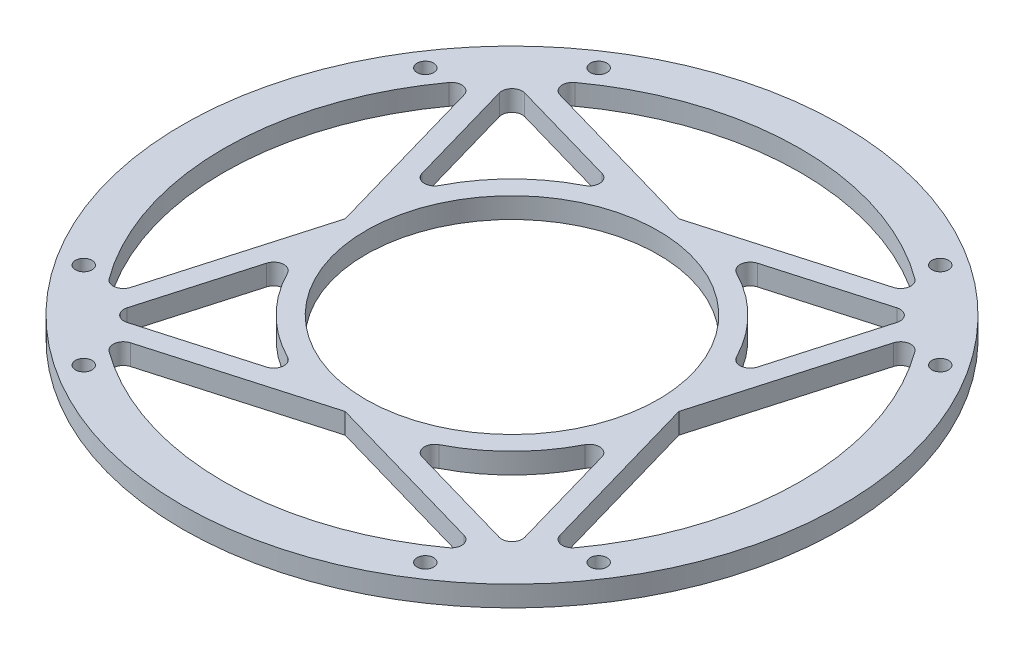
from build123d import *

# Parameters (mm, degrees)
SKETCH1_R                = 101.6
BOSS_EXTRUDE1_DEPTH      = 6.35
SKETCH4_R                = 45.085
CUT_EXTRUDE1_DEPTH       = 144.824345992
CUT_EXTRUDE2_DEPTH       = 144.824345992
F_10_CLEARANCE_HOLE1_D   = 5.1054
FILLET1_R                = 3.175
CIRPATTERN1_COUNT        = 4
FILLET1_OF_CIRPATTERN1_R = 3.175


with BuildPart() as part:
    # Sketch1 → Boss-Extrude1 (new body)
    with BuildSketch(Plane(origin=(0, 0, 0), x_dir=(1, 0, 0), z_dir=(0, 1, 0))):
        Circle(SKETCH1_R)
    extrude(amount=BOSS_EXTRUDE1_DEPTH)

    # Sketch4 → Cut-Extrude1 (cut, through all)
    with BuildSketch(Plane(origin=(0, 6.35, 0), x_dir=(1, 0, 0), z_dir=(0, 1, 0))):
        Circle(SKETCH4_R)
    extrude(amount=-CUT_EXTRUDE1_DEPTH, mode=Mode.SUBTRACT)

    # Sketch5 → Cut-Extrude2 (cut, through all)
    with BuildSketch(Plane(origin=(0, 6.35, 0), x_dir=(1, 0, 0), z_dir=(0, 1, 0))):
        with BuildLine():
            Line((-67.897166437, 57.386277017), (-51.435, 0))
            Line((-51.435, 0), (-88.9, 0))
            ThreePointArc((-88.9, 0), (-83.484334148, 30.554475153), (-67.897166437, 57.386277017))
        make_face()
        with BuildLine():
            Line((0, 88.9), (0, 51.435))
            Line((0, 51.435), (-57.386277017, 67.897166437))
            ThreePointArc((-57.386277017, 67.897166437), (-30.554475153, 83.484334148), (0, 88.9))
        make_face()
        with BuildLine():
            Line((-15.113493601, 49.16443365), (-62.861792847, 62.861792847))
            Line((-62.861792847, 62.861792847), (-49.16443365, 15.113493601))
            ThreePointArc((-49.16443365, 15.113493601), (-36.37003729, 36.37003729), (-15.113493601, 49.16443365))
        make_face()
    cut_extrude2 = extrude(amount=-CUT_EXTRUDE2_DEPTH, mode=Mode.SUBTRACT)

    # #10 Clearance Hole1 (through all)
    with Locations(Plane(origin=(0, 6.35, 0), x_dir=(1, 0, 0), z_dir=(0, 1, 0))):
        with Locations((52.651418547, 79.375), (79.375, 52.651418547), (-52.651418547, 79.375), (-79.375, 52.651418547), (79.375, -52.651418547), (52.651418547, -79.375), (-52.651418547, -79.375), (-79.375, -52.651418547)):
            Hole(F_10_CLEARANCE_HOLE1_D / 2)

    # Fillet1
    fillet1_edges = [part.edges().sort_by_distance(p)[0] for p in [
        (-57.386277017, 3.175, -67.897166437),
        (-49.16443365, 3.175, -15.113493601),
        (-15.113493601, 3.175, -49.16443365),
        (-62.861792847, 3.175, -62.861792847),
        (-67.897166437, 3.175, -57.386277017),
    ]]
    fillet(fillet1_edges, radius=FILLET1_R)

    # CirPattern1: Cut-Extrude2 ×4 about axis
    cirpattern1_axis = Axis((0, 6.35, 0), (0, -1, 0))
    for i in range(1, CIRPATTERN1_COUNT):
        add(cut_extrude2.rotate(cirpattern1_axis, i * 360 / CIRPATTERN1_COUNT), mode=Mode.SUBTRACT)

    # Fillet1 of CirPattern1
    fillet1_of_cirpattern1_edges = [part.edges().sort_by_distance(p)[0] for p in [
        (67.897166437, 3.175, -57.386277017),
        (15.113493601, 3.175, -49.16443365),
        (49.16443365, 3.175, -15.113493601),
        (62.861792847, 3.175, -62.861792847),
        (57.386277017, 3.175, -67.897166437),
        (57.386277017, 3.175, 67.897166437),
        (49.16443365, 3.175, 15.113493601),
        (15.113493601, 3.175, 49.16443365),
        (62.861792847, 3.175, 62.861792847),
        (67.897166437, 3.175, 57.386277017),
        (-67.897166437, 3.175, 57.386277017),
        (-15.113493601, 3.175, 49.16443365),
        (-49.16443365, 3.175, 15.113493601),
        (-62.861792847, 3.175, 62.861792847),
        (-57.386277017, 3.175, 67.897166437),
    ]]
    fillet(fillet1_of_cirpattern1_edges, radius=FILLET1_OF_CIRPATTERN1_R)


solid = part.part
